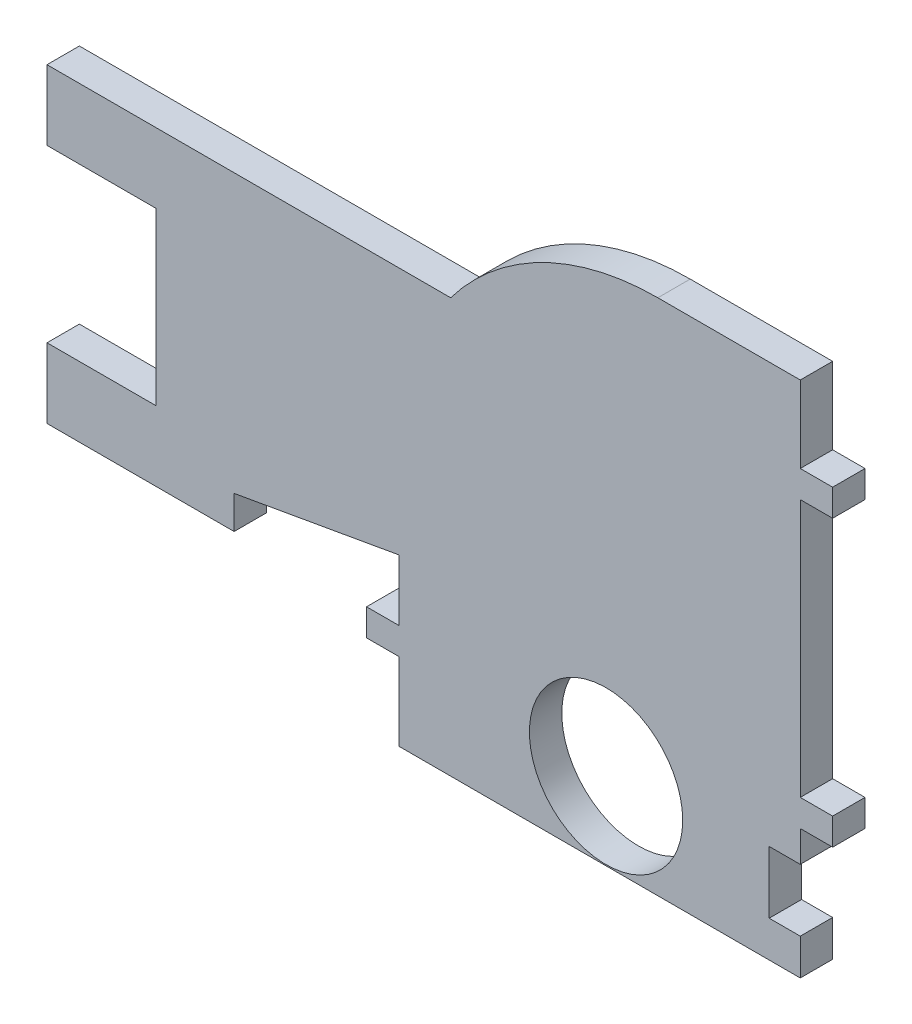
from build123d import *

# Parameters (mm, degrees)
SKETCH1_R           = 3.7592
BOSS_EXTRUDE1_DEPTH = 1.5875


with BuildPart() as part:
    # Sketch1 → Boss-Extrude1 (new body)
    with BuildSketch(Plane.XY):
        with BuildLine():
            Line((-18.241771939, 2.890724209), (-10.16, 4.318))
            Line((-10.16, 4.318), (-10.16, 1.3208))
            Line((-10.16, 1.3208), (-11.7475, 1.3208))
            Line((-11.7475, 1.3208), (-11.7475, 0))
            Line((-11.7475, 0), (-10.16, 0))
            Line((-10.16, 0), (-10.16, -3.81))
            Line((-10.16, -3.81), (9.525, -3.81))
            Line((9.525, -3.81), (9.525, -2.032))
            Line((9.525, -2.032), (8.001, -2.032))
            Line((8.001, -2.032), (8.001, 1.016))
            Line((8.001, 1.016), (9.525, 1.016))
            Line((9.525, 1.016), (9.525, 2.54))
            Line((9.525, 2.54), (11.1125, 2.54))
            Line((11.1125, 2.54), (11.1125, 3.8608))
            Line((11.1125, 3.8608), (9.525, 3.8608))
            Line((9.525, 3.8608), (9.525, 16.51))
            Line((9.525, 16.51), (11.1125, 16.51))
            Line((11.1125, 16.51), (11.1125, 17.8308))
            Line((11.1125, 17.8308), (9.525, 17.8308))
            Line((9.525, 17.8308), (9.525, 21.59))
            Line((9.525, 21.59), (2.54, 21.59))
            ThreePointArc((2.54, 21.59), (-3.139612663, 20.249225326), (-7.62, 16.51))
            Line((-7.62, 16.51), (-27.418921519, 16.51))
            Line((-27.418921519, 16.51), (-27.418921519, 13.081))
            Line((-27.418921519, 13.081), (-22.084921519, 13.081))
            Line((-22.084921519, 13.081), (-22.084921519, 4.699))
            Line((-22.084921519, 4.699), (-27.418921519, 4.699))
            Line((-27.418921519, 4.699), (-27.418921519, 1.27))
            Line((-27.418921519, 1.27), (-18.241771939, 1.27))
            Line((-18.241771939, 1.27), (-18.241771939, 2.890724209))
        make_face()
        Circle(SKETCH1_R, mode=Mode.SUBTRACT)
    extrude(amount=BOSS_EXTRUDE1_DEPTH)


solid = part.part
